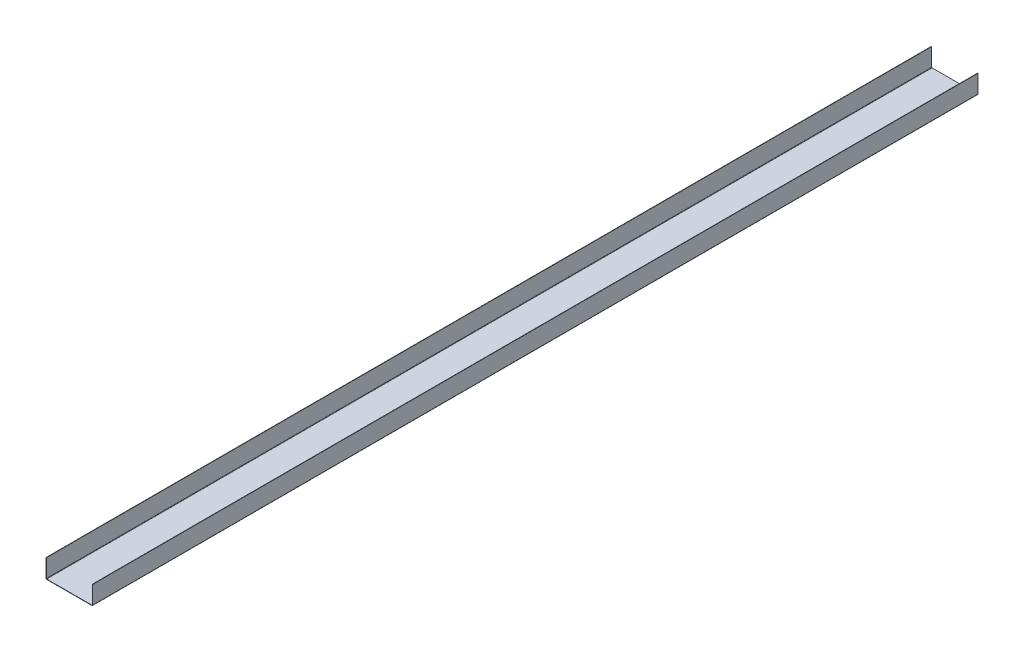
from build123d import *

# Parameters (mm, degrees)
SM_BASE_FLANGE_2_DEPTH = 1900


# Sheet-metal steps are written as plain solids
with BuildPart() as part:
    # Эскиз1 → Базовая кромка2 (new body)
    with BuildSketch(Plane.XY):
        with BuildLine():
            Line((-50, 40), (-50, 1.5))
            ThreePointArc((-50, 1.5), (-49.560660172, 0.439339828), (-48.5, 0))
            Line((-48.5, 0), (48.5, 0))
            ThreePointArc((48.5, 0), (49.560660172, 0.439339828), (50, 1.5))
            Line((50, 1.5), (50, 40))
            Line((50, 40), (49.25, 40))
            Line((49.25, 40), (49.25, 1.5))
            ThreePointArc((49.25, 1.5), (49.030330086, 0.969669914), (48.5, 0.75))
            Line((48.5, 0.75), (-48.5, 0.75))
            ThreePointArc((-48.5, 0.75), (-49.030330086, 0.969669914), (-49.25, 1.5))
            Line((-49.25, 1.5), (-49.25, 40))
            Line((-49.25, 40), (-50, 40))
        make_face()
    extrude(amount=SM_BASE_FLANGE_2_DEPTH)


solid = part.part
